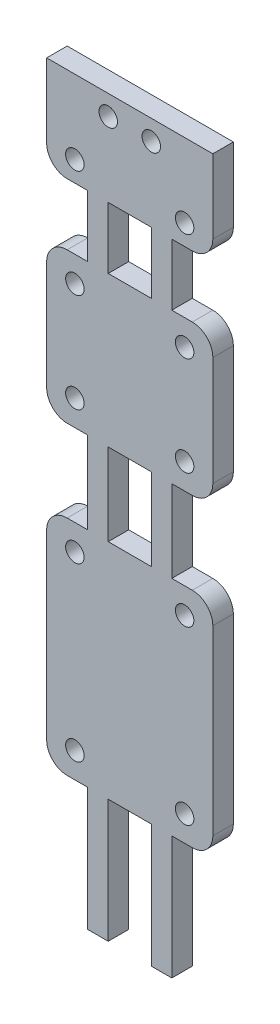
from build123d import *

# Parameters (mm, degrees)
SKETCH1_R           = 0.9
SKETCH1_W           = 4.2
SKETCH1_H           = 6
SKETCH1_H_2         = 8
BOSS_EXTRUDE1_DEPTH = 2


with BuildPart() as part:
    # Sketch1 → Boss-Extrude1 (new body)
    with BuildSketch(Plane.XY):
        with BuildLine():
            Line((2, 47.74), (4, 47.74))
            Line((4, 47.74), (4, 55.74))
            Line((4, 55.74), (2, 55.74))
            ThreePointArc((2, 55.74), (0.585786438, 56.325786438), (0, 57.74))
            Line((0, 57.74), (0, 68.385))
            ThreePointArc((0, 68.385), (0.585786438, 69.799213562), (2, 70.385))
            Line((2, 70.385), (4, 70.385))
            Line((4, 70.385), (4, 76.385))
            Line((4, 76.385), (2, 76.385))
            ThreePointArc((2, 76.385), (0.585786438, 76.970786438), (0, 78.385))
            Line((0, 78.385), (0, 85.59))
            Line((0, 85.59), (16.2, 85.59))
            Line((16.2, 85.59), (16.2, 78.385))
            ThreePointArc((16.2, 78.385), (15.614213562, 76.970786438), (14.2, 76.385))
            Line((14.2, 76.385), (12.2, 76.385))
            Line((12.2, 76.385), (12.2, 70.385))
            Line((12.2, 70.385), (14.2, 70.385))
            ThreePointArc((14.2, 70.385), (15.614213562, 69.799213562), (16.2, 68.385))
            Line((16.2, 68.385), (16.2, 57.74))
            ThreePointArc((16.2, 57.74), (15.614213562, 56.325786438), (14.2, 55.74))
            Line((14.2, 55.74), (12.2, 55.74))
            Line((12.2, 55.74), (12.2, 47.74))
            Line((12.2, 47.74), (14.2, 47.74))
            ThreePointArc((14.2, 47.74), (15.614213562, 47.154213562), (16.2, 45.74))
            Line((16.2, 45.74), (16.2, 28))
            ThreePointArc((16.2, 28), (15.614213562, 26.585786438), (14.2, 26))
            Line((14.2, 26), (12.2, 26))
            Line((12.2, 26), (12.2, 14))
            Line((12.2, 14), (10.2, 14))
            Line((10.2, 14), (10.2, 26))
            Line((10.2, 26), (6, 26))
            Line((6, 26), (6, 14))
            Line((6, 14), (4, 14))
            Line((4, 14), (4, 26))
            Line((4, 26), (2, 26))
            ThreePointArc((2, 26), (0.585786438, 26.585786438), (0, 28))
            Line((0, 28), (0, 45.74))
            ThreePointArc((0, 45.74), (0.585786438, 47.154213562), (2, 47.74))
        make_face()
        with Locations((13.45, 45.24)):
            Circle(SKETCH1_R, mode=Mode.SUBTRACT)
        with Locations((2.75, 67.885)):
            Circle(SKETCH1_R, mode=Mode.SUBTRACT)
        with Locations((13.45, 58.24)):
            Circle(SKETCH1_R, mode=Mode.SUBTRACT)
        with Locations((13.45, 78.385)):
            Circle(SKETCH1_R, mode=Mode.SUBTRACT)
        with Locations((2.75, 28.5)):
            Circle(SKETCH1_R, mode=Mode.SUBTRACT)
        with Locations((2.75, 78.385)):
            Circle(SKETCH1_R, mode=Mode.SUBTRACT)
        with Locations((2.75, 58.24)):
            Circle(SKETCH1_R, mode=Mode.SUBTRACT)
        with Locations((6, 83.635)):
            Circle(SKETCH1_R, mode=Mode.SUBTRACT)
        with Locations((13.45, 28.5)):
            Circle(SKETCH1_R, mode=Mode.SUBTRACT)
        with Locations((13.45, 67.885)):
            Circle(SKETCH1_R, mode=Mode.SUBTRACT)
        with Locations((10.2, 83.635)):
            Circle(SKETCH1_R, mode=Mode.SUBTRACT)
        with Locations((2.75, 45.24)):
            Circle(SKETCH1_R, mode=Mode.SUBTRACT)
        with Locations((8.1, 73.385)):
            Rectangle(SKETCH1_W, SKETCH1_H, mode=Mode.SUBTRACT)
        with Locations((8.1, 51.74)):
            Rectangle(SKETCH1_W, SKETCH1_H_2, mode=Mode.SUBTRACT)
    extrude(amount=BOSS_EXTRUDE1_DEPTH)


solid = part.part
